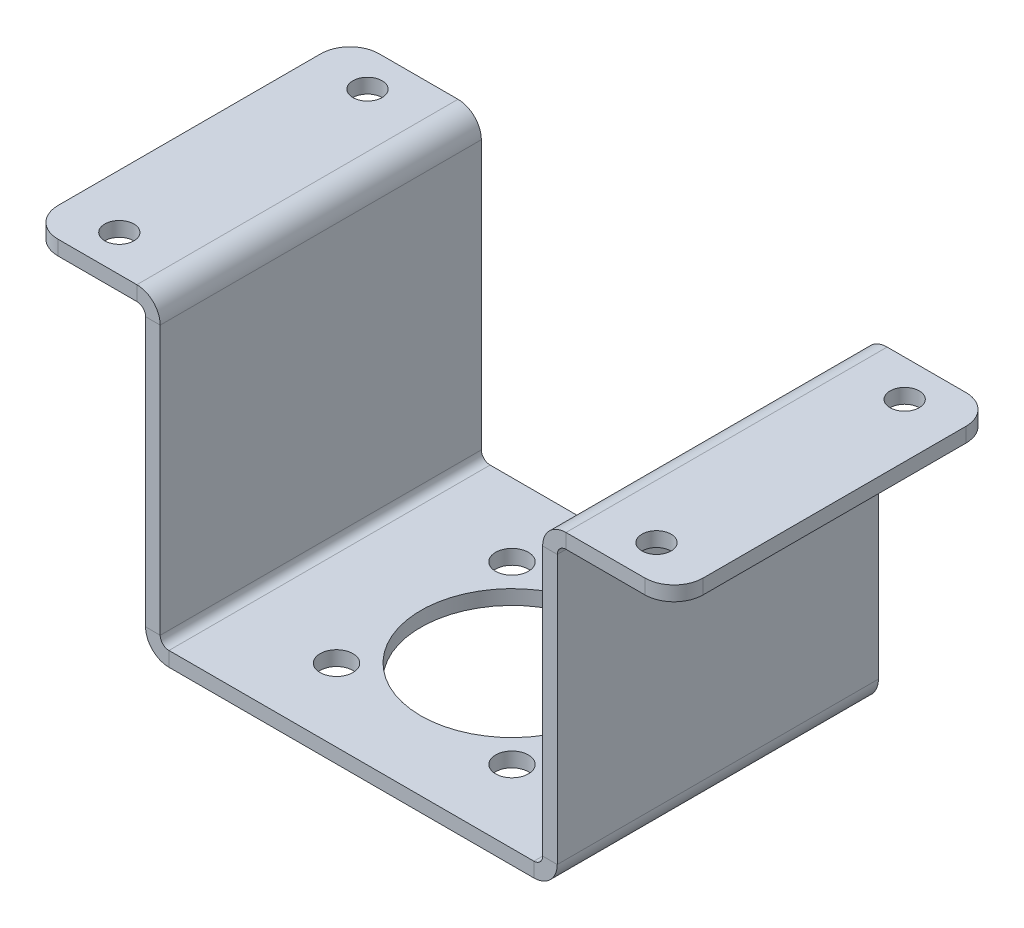
from build123d import *

# Parameters (mm, degrees)
SKETCH1_W               = 50
SKETCH1_H               = 44
BASE_FLANGE1_DEPTH      = 2
EDGE_FLANGE1_DEPTH      = 44
EDGE_FLANGE1_BEND_DEPTH = 44
EDGE_FLANGE2_DEPTH      = 44
EDGE_FLANGE2_BEND_DEPTH = 44
SKETCH21_R              = 12.5
SKETCH21_R_2            = 2.25
CUT_EXTRUDE1_DEPTH      = 2
SKETCH22_R              = 2
CUT_EXTRUDE2_DEPTH      = 2
FILLET1_R               = 4


# Sheet-metal steps are written as plain solids
with BuildPart() as part:
    # Sketch1 → Base-Flange1 (new body)
    with BuildSketch(Plane(origin=(0, 0, 0), x_dir=(1, 0, 0), z_dir=(0, 1, 0))):
        with Locations((45, -1)):
            Rectangle(SKETCH1_W, SKETCH1_H)
    extrude(amount=-BASE_FLANGE1_DEPTH)

    # Edge-Flange1 section (across the edge) → Edge-Flange1 (add)
    with BuildSketch(Plane(origin=(18.8, 0, -21), x_dir=(1, 0, 0), z_dir=(0, 0, 1))):
        with BuildLine():
            Line((-2, 1.2), (-2, 38))
            Line((-2, 38), (0, 38))
            Line((0, 38), (0, 1.2))
            ThreePointArc((0, 1.2), (0.351471863, 0.351471863), (1.2, 0))
            Line((1.2, 0), (1.2, -2))
            ThreePointArc((1.2, -2), (-1.0627417, -1.0627417), (-2, 1.2))
        make_face()
    extrude(amount=EDGE_FLANGE1_DEPTH)

    # Edge-Flange1 section 2 (across the edge) → Edge-Flange1 bend (add)
    with BuildSketch(Plane(origin=(71.2, 0, 23), x_dir=(-1, 0, 0), z_dir=(0, 0, -1))):
        with BuildLine():
            Line((-2, 1.2), (-2, 38))
            Line((-2, 38), (0, 38))
            Line((0, 38), (0, 1.2))
            ThreePointArc((0, 1.2), (0.351471863, 0.351471863), (1.2, 0))
            Line((1.2, 0), (1.2, -2))
            ThreePointArc((1.2, -2), (-1.0627417, -1.0627417), (-2, 1.2))
        make_face()
    extrude(amount=EDGE_FLANGE1_BEND_DEPTH)

    # Edge-Flange2 section (across the edge) → Edge-Flange2 (add)
    with BuildSketch(Plane(origin=(73.2, 39.2, -21), x_dir=(0, -1, 0), z_dir=(0, 0, 1))):
        with BuildLine():
            Line((-2, 1.2), (-2, 16))
            Line((-2, 16), (0, 16))
            Line((0, 16), (0, 1.2))
            ThreePointArc((0, 1.2), (0.351471863, 0.351471863), (1.2, 0))
            Line((1.2, 0), (1.2, -2))
            ThreePointArc((1.2, -2), (-1.0627417, -1.0627417), (-2, 1.2))
        make_face()
    extrude(amount=EDGE_FLANGE2_DEPTH)

    # Edge-Flange2 section 2 (across the edge) → Edge-Flange2 bend (add)
    with BuildSketch(Plane(origin=(16.8, 39.2, 23), x_dir=(0, -1, 0), z_dir=(0, 0, -1))):
        with BuildLine():
            Line((-2, 1.2), (-2, 16))
            Line((-2, 16), (0, 16))
            Line((0, 16), (0, 1.2))
            ThreePointArc((0, 1.2), (0.351471863, 0.351471863), (1.2, 0))
            Line((1.2, 0), (1.2, -2))
            ThreePointArc((1.2, -2), (-1.0627417, -1.0627417), (-2, 1.2))
        make_face()
    extrude(amount=EDGE_FLANGE2_BEND_DEPTH)

    # Sketch21 → Cut-Extrude1 (cut)
    with BuildSketch(Plane.XZ.offset(2)):
        with Locations(Location((45, 1, 0), (0, 0, 270))):
            Circle(SKETCH21_R)
        with Locations(Location((57.02081528, 13.02081528, 0), (0, 0, 270))):
            Circle(SKETCH21_R_2)
        with Locations(Location((57.02081528, -11.02081528, 0), (0, 0, 270))):
            Circle(SKETCH21_R_2)
        with Locations(Location((32.97918472, -11.02081528, 0), (0, 0, 270))):
            Circle(SKETCH21_R_2)
        with Locations(Location((32.97918472, 13.02081528, 0), (0, 0, 270))):
            Circle(SKETCH21_R_2)
    extrude(amount=-CUT_EXTRUDE1_DEPTH, mode=Mode.SUBTRACT)

    # Sketch22 → Cut-Extrude2 (cut)
    with BuildSketch(Plane.XZ.offset(-39.2)):
        with Locations(Location((8.2, 18, 0), (0, 0, 270))):
            Circle(SKETCH22_R)
        with Locations(Location((8.2, -16, 0), (0, 0, 270))):
            Circle(SKETCH22_R)
        with Locations(Location((81.8, -16, 0), (0, 0, 90))):
            Circle(SKETCH22_R)
        with Locations(Location((81.8, 18, 0), (0, 0, 90))):
            Circle(SKETCH22_R)
    extrude(amount=-CUT_EXTRUDE2_DEPTH, mode=Mode.SUBTRACT)

    # Fillet1
    fillet1_edges = [part.edges().sort_by_distance(p)[0] for p in [
        (89.2, 40.2, -21),
        (89.2, 40.2, 23),
        (0.8, 40.2, 23),
        (0.8, 40.2, -21),
    ]]
    fillet(fillet1_edges, radius=FILLET1_R)


solid = part.part
